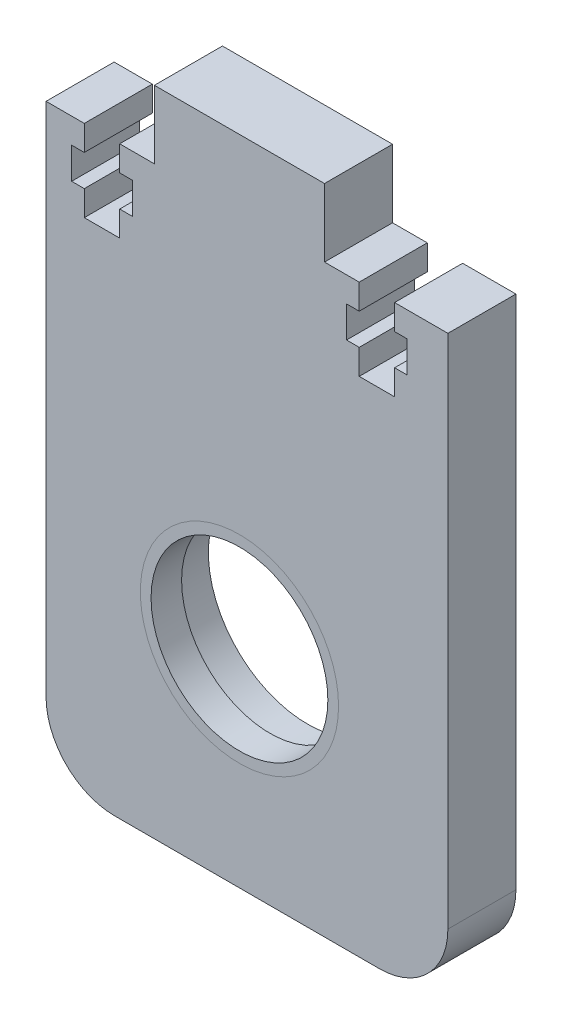
from build123d import *

# Parameters (mm, degrees)
SKETCH12_W           = 75
SKETCH12_H           = 109.1
BOSS_EXTRUDE10_DEPTH = 12.7
SKETCH25_R           = 18.5
CUT_EXTRUDE1_DEPTH   = 176.691771475
SKETCH26_R           = 18.5
SKETCH26_R_2         = 16.5
BOSS_EXTRUDE15_DEPTH = 5.7
FILLET1_R            = 12.8
CUT_EXTRUDE2_DEPTH   = 176.691771475
BOSS_EXTRUDE16_DEPTH = 12.7


with BuildPart() as part:
    # Sketch12 → Boss-Extrude10 (new body)
    with BuildSketch(Plane.XY):
        with Locations((99.625849364, 54.55)):
            Rectangle(SKETCH12_W, SKETCH12_H)
    extrude(amount=BOSS_EXTRUDE10_DEPTH)

    # Sketch25 → Cut-Extrude1 (cut, through all)
    with BuildSketch(Plane.XY.offset(12.7)):
        with Locations((98.219620603, 38.627603634)):
            Circle(SKETCH25_R)
    extrude(amount=-CUT_EXTRUDE1_DEPTH, mode=Mode.SUBTRACT)

    # Fillet1
    fillet1_edges = [part.edges().sort_by_distance(p)[0] for p in [
        (137.125849364, 0, 6.35),
        (62.125849364, 0, 6.35),
    ]]
    fillet(fillet1_edges, radius=FILLET1_R)

    # Sketch27 → Cut-Extrude2 (cut, through all)
    with BuildSketch(Plane(origin=(0, 0, 0), x_dir=(-1, 0, 0), z_dir=(0, 0, -1))):
        Polygon((-69.261558301, 109.1), (-69.261558301, 104.401), (-66.899558301, 104.401), (-66.899558301, 98.559), (-69.261558301, 98.559), (-69.261558301, 93.86), (-75.865558301, 93.86), (-75.865558301, 98.559), (-78.227558301, 98.559), (-78.227558301, 104.401), (-75.865558301, 104.401), (-75.865558301, 109.1), align=None)
        Polygon((-120.573682905, 104.401), (-120.573682905, 109.1), (-127.177682905, 109.1), (-127.177682905, 104.401), (-129.539682905, 104.401), (-129.539682905, 98.559), (-127.177682905, 98.559), (-127.177682905, 93.86), (-120.573682905, 93.86), (-120.573682905, 98.559), (-118.211682905, 98.559), (-118.211682905, 104.401), align=None)
    extrude(amount=-CUT_EXTRUDE2_DEPTH, mode=Mode.SUBTRACT)

    # Sketch28 → Boss-Extrude16 (add)
    with BuildSketch(Plane(origin=(0, 109.1, 0), x_dir=(1, 0, 0), z_dir=(0, 1, 0))):
        Polygon((98.219620603, 0), (82.344620603, 0), (82.344620603, -12.7), (114.094620603, -12.7), (114.094620603, 0), align=None)
    extrude(amount=BOSS_EXTRUDE16_DEPTH)


with BuildPart() as body_2:
    # Sketch26 → Boss-Extrude15 (new body)
    with BuildSketch(Plane.XY.offset(12.7)):
        with Locations((98.219620603, 38.627603634)):
            Circle(SKETCH26_R)
        with Locations((98.219620603, 38.627603634)):
            Circle(SKETCH26_R_2, mode=Mode.SUBTRACT)
    extrude(amount=-BOSS_EXTRUDE15_DEPTH)


solid = Compound([part.part, body_2.part])
